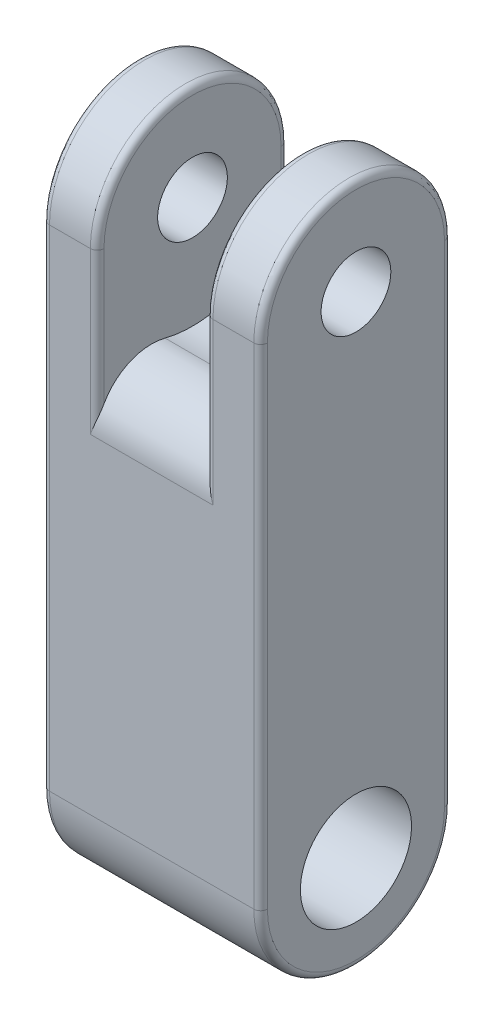
from build123d import *

# Parameters (mm, degrees)
SKETCH1_R           = 3.2385
SKETCH1_R_2         = 2.032
BOSS_EXTRUDE1_DEPTH = 6.35
SKETCH2_R           = 6.5
CUT_EXTRUDE1_DEPTH  = 3.175
FILLET1_R           = 3.175
FILLET2_R           = 0.396875


with BuildPart() as part:
    # Sketch1 → Boss-Extrude1 (new, symmetric)
    with BuildSketch(Plane(origin=(0, 0, 0), x_dir=(0, 0, -1), z_dir=(1, 0, 0))):
        with BuildLine():
            Line((-5.55625, 0), (-5.55625, 28.575))
            ThreePointArc((-5.55625, 28.575), (0, 34.13125), (5.55625, 28.575))
            Line((5.55625, 28.575), (5.55625, 0))
            ThreePointArc((5.55625, 0), (0, -5.55625), (-5.55625, 0))
        make_face()
        Circle(SKETCH1_R, mode=Mode.SUBTRACT)
        with Locations((0, 28.575)):
            Circle(SKETCH1_R_2, mode=Mode.SUBTRACT)
    extrude(amount=BOSS_EXTRUDE1_DEPTH, both=True)

    # Sketch2 → Cut-Extrude1 (cut, symmetric)
    with BuildSketch(Plane(origin=(0, 0, 0), x_dir=(0, 0, -1), z_dir=(1, 0, 0))):
        with Locations((0, 28.575)):
            Circle(SKETCH2_R)
    extrude(amount=CUT_EXTRUDE1_DEPTH, both=True, mode=Mode.SUBTRACT)

    # Fillet1
    fillet1_edges = [part.edges().sort_by_distance(p)[0] for p in [
        (0, 25.20185815, 5.55625),
        (0, 25.20185815, -5.55625),
    ]]
    fillet(fillet1_edges, radius=FILLET1_R)

    # Fillet2
    fillet2_edges = [part.edges().sort_by_distance(p)[0] for p in [
        (6.35, 14.2875, -5.55625),
        (6.35, -5.55625, 0),
        (6.35, 14.2875, 5.55625),
        (-6.35, 14.2875, -5.55625),
        (-6.35, -5.55625, 0),
        (-6.35, 14.2875, 5.55625),
        (6.35, 34.13125, 0),
        (-6.35, 34.13125, 0),
        (-3.175, 23.886309526, -5.55625),
        (-3.175, 23.886309526, 5.55625),
        (3.175, 23.886309526, -5.55625),
        (3.175, 23.886309526, 5.55625),
        (-3.175, 34.13125, 0),
        (3.175, 34.13125, 0),
    ]]
    fillet(fillet2_edges, radius=FILLET2_R)


solid = part.part
